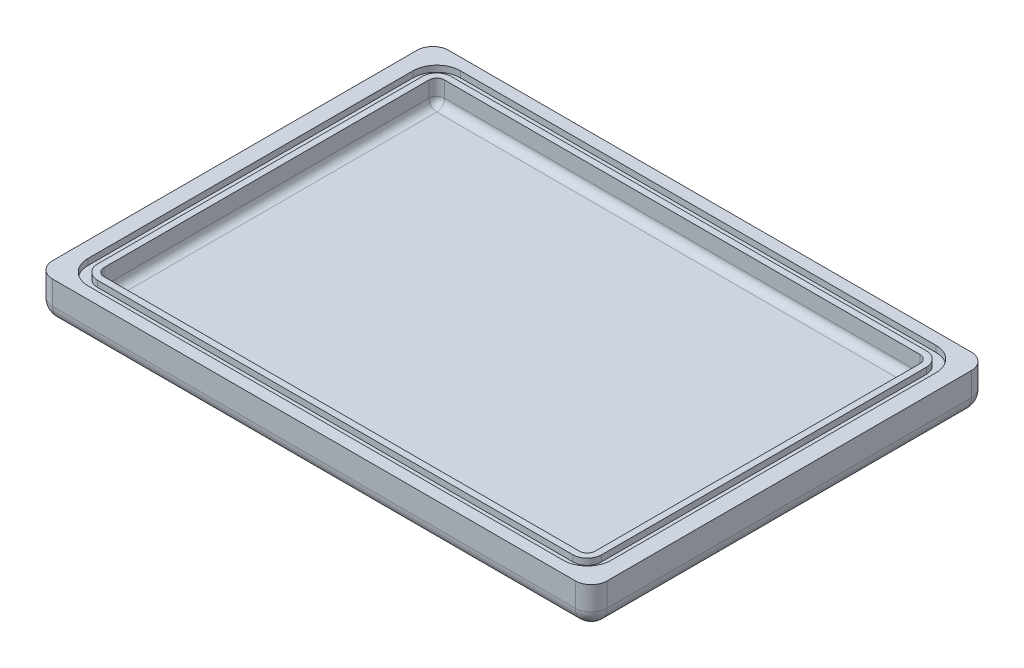
from build123d import *

# Parameters (mm, degrees)
SKETCH1_W           = 177.8
SKETCH1_H           = 127
BOSS_EXTRUDE1_DEPTH = 12.7
FILLET1_R           = 5.08
SKETCH2_W           = 157.48
SKETCH2_H           = 109.22
CUT_EXTRUDE1_DEPTH  = 7.62
FILLET2_R           = 2.54
CUT_EXTRUDE2_DEPTH  = 1.9812


with BuildPart() as part:
    # Sketch1 → Boss-Extrude1 (new body)
    with BuildSketch(Plane(origin=(0, 0, 0), x_dir=(1, 0, 0), z_dir=(0, 1, 0))):
        with Locations((88.9, 63.5)):
            Rectangle(SKETCH1_W, SKETCH1_H)
    extrude(amount=BOSS_EXTRUDE1_DEPTH)

    # Fillet1
    fillet1_edges = [part.edges().sort_by_distance(p)[0] for p in [
        (177.8, 0, -63.5),
        (88.9, 0, 0),
        (0, 0, -63.5),
        (88.9, 0, -127),
        (177.8, 6.35, -127),
        (0, 6.35, -127),
        (177.8, 6.35, 0),
        (0, 6.35, 0),
    ]]
    fillet(fillet1_edges, radius=FILLET1_R)

    # Sketch2 → Cut-Extrude1 (cut)
    with BuildSketch(Plane(origin=(0, 12.7, 0), x_dir=(1, 0, 0), z_dir=(0, 1, 0))):
        with Locations((88.9, 63.5)):
            Rectangle(SKETCH2_W, SKETCH2_H)
    extrude(amount=-CUT_EXTRUDE1_DEPTH, mode=Mode.SUBTRACT)

    # Fillet2
    fillet2_edges = [part.edges().sort_by_distance(p)[0] for p in [
        (88.9, 5.08, -118.11),
        (167.64, 5.08, -63.5),
        (88.9, 5.08, -8.89),
        (10.16, 5.08, -63.5),
        (10.16, 8.89, -8.89),
        (167.64, 8.89, -8.89),
        (167.64, 8.89, -118.11),
        (10.16, 8.89, -118.11),
    ]]
    fillet(fillet2_edges, radius=FILLET2_R)

    # Sketch3 → Cut-Extrude2 (cut)
    with BuildSketch(Plane(origin=(0, 12.7, 0), x_dir=(1, 0, 0), z_dir=(0, 1, 0))):
        with BuildLine():
            Line((165.1, 123.2154), (12.7, 123.2154))
            ThreePointArc((12.7, 123.2154), (7.293885815, 120.976114185), (5.0546, 115.57))
            Line((5.0546, 115.57), (5.0546, 11.43))
            ThreePointArc((5.0546, 11.43), (7.293885815, 6.023885815), (12.7, 3.7846))
            Line((12.7, 3.7846), (165.1, 3.7846))
            ThreePointArc((165.1, 3.7846), (170.506114185, 6.023885815), (172.7454, 11.43))
            Line((172.7454, 11.43), (172.7454, 115.57))
            ThreePointArc((172.7454, 115.57), (170.506114185, 120.976114185), (165.1, 123.2154))
        make_face()
        with BuildLine():
            Line((169.672, 11.43), (169.672, 115.57))
            ThreePointArc((169.672, 115.57), (168.332892204, 118.802892204), (165.1, 120.142))
            Line((165.1, 120.142), (12.7, 120.142))
            ThreePointArc((12.7, 120.142), (9.467107796, 118.802892204), (8.128, 115.57))
            Line((8.128, 115.57), (8.128, 11.43))
            ThreePointArc((8.128, 11.43), (9.467107796, 8.197107796), (12.7, 6.858))
            Line((12.7, 6.858), (165.1, 6.858))
            ThreePointArc((165.1, 6.858), (168.332892204, 8.197107796), (169.672, 11.43))
        make_face(mode=Mode.SUBTRACT)
    extrude(amount=-CUT_EXTRUDE2_DEPTH, mode=Mode.SUBTRACT)


solid = part.part
